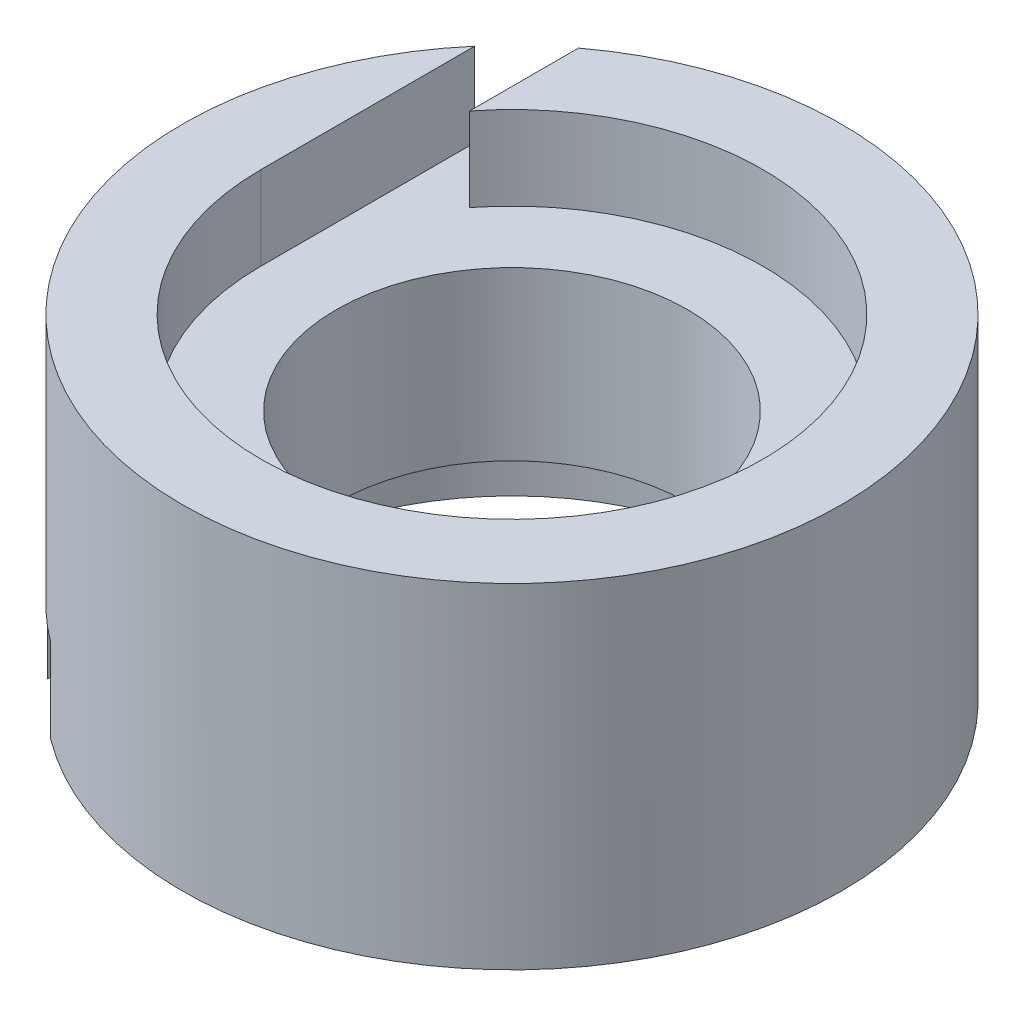
from build123d import *

# Parameters (mm, degrees)
SKETCH1_R           = 25.019
SKETCH1_R_2         = 13.335
BOSS_EXTRUDE1_DEPTH = 12.7
CUT_EXTRUDE1_DEPTH  = 6.35
CIRPATTERN1_COUNT   = 2


with BuildPart() as part:
    # Sketch1 → Boss-Extrude1 (new, symmetric)
    with BuildSketch(Plane(origin=(0, 0, 0), x_dir=(1, 0, 0), z_dir=(0, 1, 0))):
        Circle(SKETCH1_R)
        Circle(SKETCH1_R_2, mode=Mode.SUBTRACT)
    extrude(amount=BOSS_EXTRUDE1_DEPTH, both=True)

    # Sketch2 → Cut-Extrude1 (cut)
    with BuildSketch(Plane(origin=(0, 12.7, 0), x_dir=(1, 0, 0), z_dir=(0, 1, 0))):
        with BuildLine():
            Line((-19.05, 0), (-19.05, 16.218750291))
            ThreePointArc((-19.05, 16.218750291), (-17.124595923, 18.24002674), (-14.986, 20.034224842))
            Line((-14.986, 20.034224842), (-14.986, 11.761050293))
            ThreePointArc((-14.986, 11.761050293), (18.005357536, -6.221703947), (-19.05, 0))
        make_face()
    cut_extrude1 = extrude(amount=-CUT_EXTRUDE1_DEPTH, mode=Mode.SUBTRACT)

    # CirPattern1: Cut-Extrude1 ×2 about axis
    cirpattern1_axis = Axis((34.925, 0, 0), (-1, 0, 0))
    for i in range(1, CIRPATTERN1_COUNT):
        add(cut_extrude1.rotate(cirpattern1_axis, i * 360 / CIRPATTERN1_COUNT), mode=Mode.SUBTRACT)


solid = part.part
